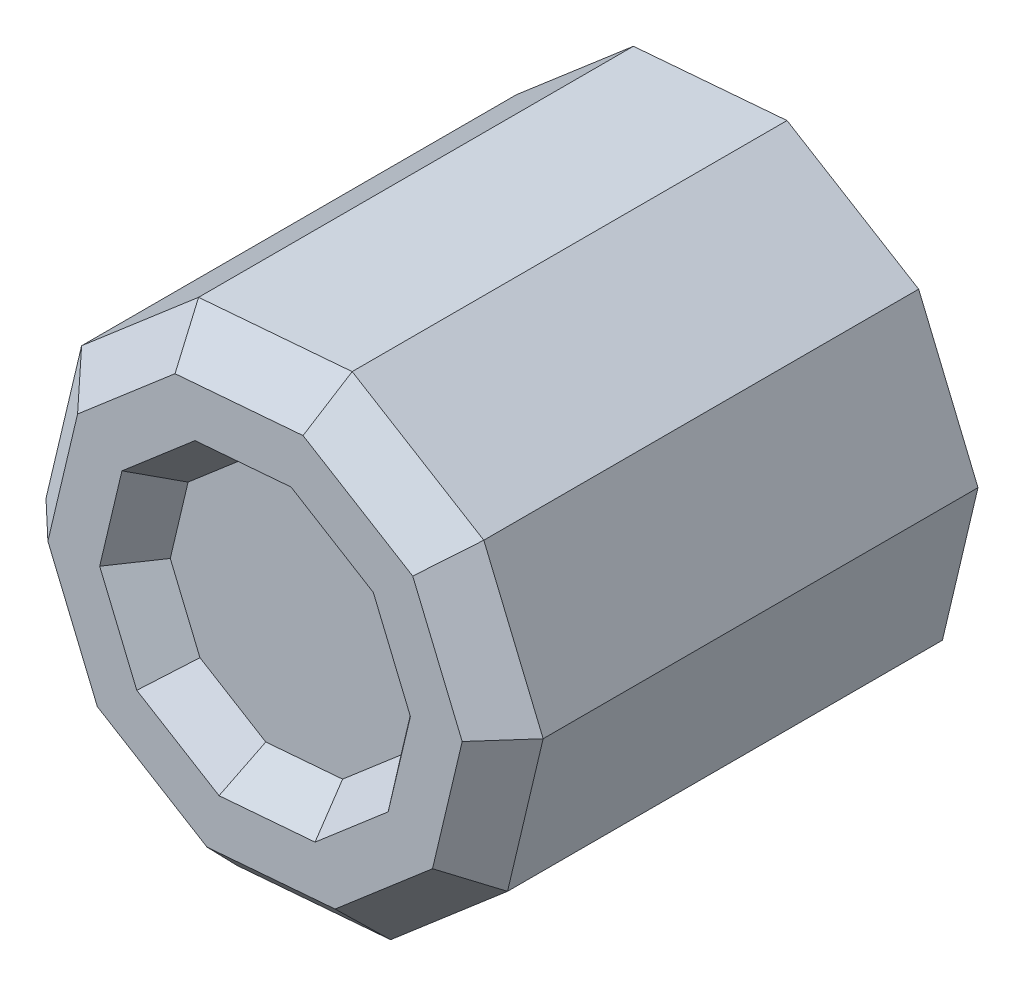
from build123d import *

# Parameters (mm, degrees)
SKETCH_1_R      = 3.05
EXTRUDE_1_DEPTH = 12
SKETCH_2_R      = 3.098235282
EXTRUDE_2_DEPTH = 2
EXTRUDE_START   = 7
EXTRUDE_3_DEPTH = 7
CHAMFER_1_SIZE  = 1


with BuildPart() as part:
    # 草图1 → 凸台-拉伸1 (new body)
    with BuildSketch(Plane.XY):
        Polygon((1.45714262, 6.138188374), (-2.429083459, 5.822385651), (-5.387482218, 3.282629506), (-6.288045884, -0.510979538), (-4.786789744, -4.109411766), (-1.45714262, -6.138188374), (2.429083459, -5.822385651), (5.387482218, -3.282629506), (6.288045884, 0.510979538), (4.786789744, 4.109411766), align=None)
        Circle(SKETCH_1_R, mode=Mode.SUBTRACT)
    extrude(amount=EXTRUDE_1_DEPTH)

    # 草图2 → 凸台-拉伸2 (add)
    with BuildSketch(Plane.XY.offset(12)):
        Circle(SKETCH_2_R)
    extrude(amount=-EXTRUDE_2_DEPTH)

    # 草图3 → 凸台-拉伸3 (add)
    with BuildSketch(Plane(origin=(0, 0, 10), x_dir=(-1, 0, 0), z_dir=(0, 0, -1)).offset(EXTRUDE_START)):
        with BuildLine():
            Line((1.45, 2.683281573), (1.45, -2.683281573))
            ThreePointArc((1.45, -2.683281573), (3.05, 0), (1.45, 2.683281573))
        make_face()
    extrude(amount=-EXTRUDE_3_DEPTH)

    # 倒角1
    chamfer_1_edges = [part.edges().sort_by_distance(p)[0] for p in [
        (5.537417814, 2.310195652, 12),
        (5.837764051, -1.385824984, 12),
        (3.908282839, -4.552507579, 12),
        (0.48597042, -5.980287012, 12),
        (-3.121966182, -5.12380007, 12),
        (-5.537417814, -2.310195652, 12),
        (-5.837764051, 1.385824984, 12),
        (-3.908282839, 4.552507579, 12),
        (-0.48597042, 5.980287012, 12),
        (3.121966182, 5.12380007, 12),
    ]]
    chamfer(chamfer_1_edges, length=CHAMFER_1_SIZE)

    # 草图5 → 切除-放样1 section 0
    with BuildSketch(Plane.XY.offset(12)):
        with BuildLine():
            Line((0.910714137, 3.836367733), (-1.518177162, 3.638991032))
            Line((-1.518177162, 3.638991032), (-3.367176386, 2.051643441))
            Line((-3.367176386, 2.051643441), (-3.930028677, -0.319362211))
            Line((-3.930028677, -0.319362211), (-2.99174359, -2.568382354))
            Line((-2.99174359, -2.568382354), (-0.910714137, -3.836367733))
            Line((-0.910714137, -3.836367733), (1.518177162, -3.638991032))
            Line((1.518177162, -3.638991032), (3.367176386, -2.051643441))
            Line((3.367176386, -2.051643441), (3.930028677, 0.319362211))
            Line((3.930028677, 0.319362211), (2.99174359, 2.568382354))
            Line((2.99174359, 2.568382354), (0.910714137, 3.836367733))
        make_face()
    # 草图4 → 切除-放样1 section 1
    with BuildSketch(Plane.XY.offset(11)):
        with BuildLine():
            Line((0.72857131, 3.069094187), (-1.21454173, 2.911192826))
            Line((-1.21454173, 2.911192826), (-2.693741109, 1.641314753))
            Line((-2.693741109, 1.641314753), (-3.144022942, -0.255489769))
            Line((-3.144022942, -0.255489769), (-2.393394872, -2.054705883))
            Line((-2.393394872, -2.054705883), (-0.72857131, -3.069094187))
            Line((-0.72857131, -3.069094187), (1.21454173, -2.911192826))
            Line((1.21454173, -2.911192826), (2.693741109, -1.641314753))
            Line((2.693741109, -1.641314753), (3.144022942, 0.255489769))
            Line((3.144022942, 0.255489769), (2.393394872, 2.054705883))
            Line((2.393394872, 2.054705883), (0.72857131, 3.069094187))
        make_face()
    loft(mode=Mode.SUBTRACT)


solid = part.part
